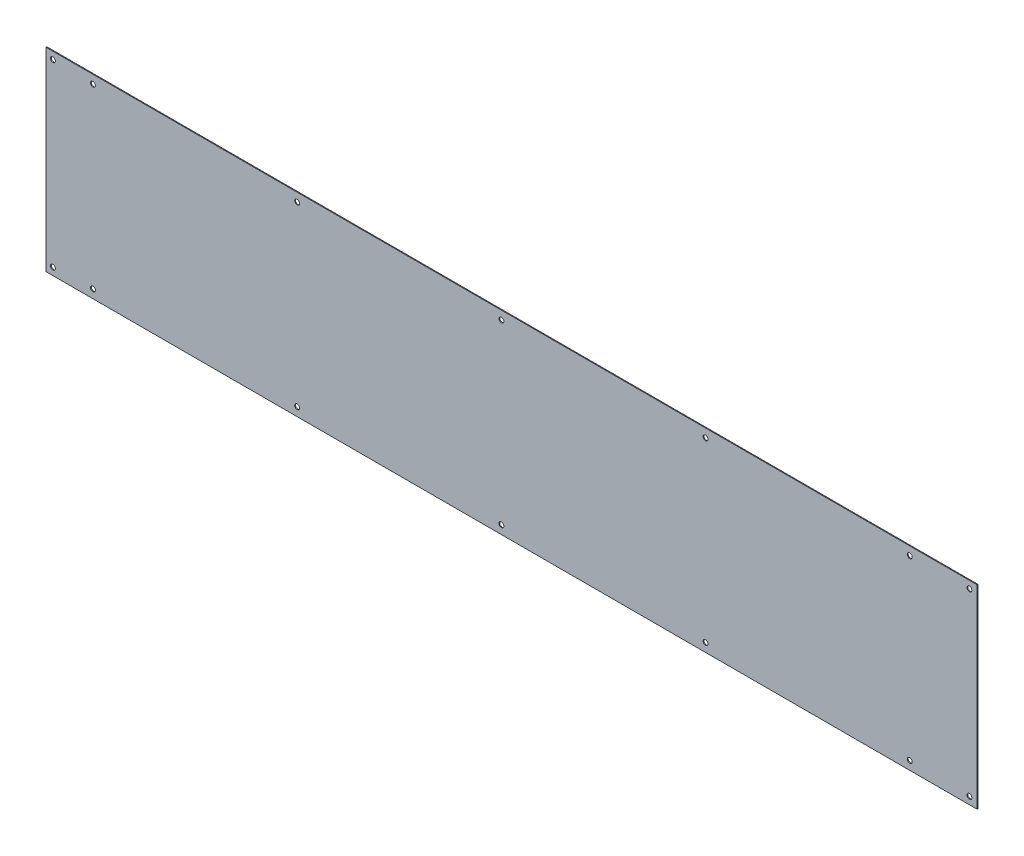
from build123d import *

# Parameters (mm, degrees)
SKETCH_1_W             = 1140
SKETCH_1_H             = 238
SKETCH_1_R             = 3
SM_BASE_FLANGE_1_DEPTH = 1
CUT_EXTRUDE_1_REACH    = 584.29
SKETCH_3_R             = 3


# Sheet-metal steps are written as plain solids
with BuildPart() as part:
    # Sketch 1 → 基体-法兰1 (new body)
    with BuildSketch(Plane.XY):
        Rectangle(SKETCH_1_W, SKETCH_1_H)
        with Locations((-561.5, 110)):
            Circle(SKETCH_1_R, mode=Mode.SUBTRACT)
        with Locations((-561.5, -110)):
            Circle(SKETCH_1_R, mode=Mode.SUBTRACT)
        with Locations((560.5, 110)):
            Circle(SKETCH_1_R, mode=Mode.SUBTRACT)
        with Locations((560.5, -110)):
            Circle(SKETCH_1_R, mode=Mode.SUBTRACT)
    extrude(amount=-SM_BASE_FLANGE_1_DEPTH)

    # 草图3 → 切除-拉伸1 (cut, up to next)
    with BuildSketch(Plane.XY, mode=Mode.PRIVATE) as cut_extrude_1_sk1:
        with Locations((-512.5, 108.5)):
            Circle(SKETCH_3_R)
    cut_extrude_1_tool1 = extrude(cut_extrude_1_sk1.sketch, amount=-CUT_EXTRUDE_1_REACH, mode=Mode.PRIVATE) & part.part
    # 草图3 → 切除-拉伸1 (cut, up to next)
    with BuildSketch(Plane.XY, mode=Mode.PRIVATE) as cut_extrude_1_sk2:
        with Locations((-262.5, 108.5)):
            Circle(SKETCH_3_R)
    cut_extrude_1_tool2 = extrude(cut_extrude_1_sk2.sketch, amount=-CUT_EXTRUDE_1_REACH, mode=Mode.PRIVATE) & part.part
    # 草图3 → 切除-拉伸1 (cut, up to next)
    with BuildSketch(Plane.XY, mode=Mode.PRIVATE) as cut_extrude_1_sk3:
        with Locations((-12.5, 108.5)):
            Circle(SKETCH_3_R)
    cut_extrude_1_tool3 = extrude(cut_extrude_1_sk3.sketch, amount=-CUT_EXTRUDE_1_REACH, mode=Mode.PRIVATE) & part.part
    # 草图3 → 切除-拉伸1 (cut, up to next)
    with BuildSketch(Plane.XY, mode=Mode.PRIVATE) as cut_extrude_1_sk4:
        with Locations((237.5, 108.5)):
            Circle(SKETCH_3_R)
    cut_extrude_1_tool4 = extrude(cut_extrude_1_sk4.sketch, amount=-CUT_EXTRUDE_1_REACH, mode=Mode.PRIVATE) & part.part
    # 草图3 → 切除-拉伸1 (cut, up to next)
    with BuildSketch(Plane.XY, mode=Mode.PRIVATE) as cut_extrude_1_sk5:
        with Locations((487.5, 108.5)):
            Circle(SKETCH_3_R)
    cut_extrude_1_tool5 = extrude(cut_extrude_1_sk5.sketch, amount=-CUT_EXTRUDE_1_REACH, mode=Mode.PRIVATE) & part.part
    # 草图3 → 切除-拉伸1 (cut, up to next)
    with BuildSketch(Plane.XY, mode=Mode.PRIVATE) as cut_extrude_1_sk6:
        with Locations((-512.5, -108.5)):
            Circle(SKETCH_3_R)
    cut_extrude_1_tool6 = extrude(cut_extrude_1_sk6.sketch, amount=-CUT_EXTRUDE_1_REACH, mode=Mode.PRIVATE) & part.part
    # 草图3 → 切除-拉伸1 (cut, up to next)
    with BuildSketch(Plane.XY, mode=Mode.PRIVATE) as cut_extrude_1_sk7:
        with Locations((-262.5, -108.5)):
            Circle(SKETCH_3_R)
    cut_extrude_1_tool7 = extrude(cut_extrude_1_sk7.sketch, amount=-CUT_EXTRUDE_1_REACH, mode=Mode.PRIVATE) & part.part
    # 草图3 → 切除-拉伸1 (cut, up to next)
    with BuildSketch(Plane.XY, mode=Mode.PRIVATE) as cut_extrude_1_sk8:
        with Locations((-12.5, -108.5)):
            Circle(SKETCH_3_R)
    cut_extrude_1_tool8 = extrude(cut_extrude_1_sk8.sketch, amount=-CUT_EXTRUDE_1_REACH, mode=Mode.PRIVATE) & part.part
    # 草图3 → 切除-拉伸1 (cut, up to next)
    with BuildSketch(Plane.XY, mode=Mode.PRIVATE) as cut_extrude_1_sk9:
        with Locations((237.5, -108.5)):
            Circle(SKETCH_3_R)
    cut_extrude_1_tool9 = extrude(cut_extrude_1_sk9.sketch, amount=-CUT_EXTRUDE_1_REACH, mode=Mode.PRIVATE) & part.part
    # 草图3 → 切除-拉伸1 (cut, up to next)
    with BuildSketch(Plane.XY, mode=Mode.PRIVATE) as cut_extrude_1_sk10:
        with Locations((487.5, -108.5)):
            Circle(SKETCH_3_R)
    cut_extrude_1_tool10 = extrude(cut_extrude_1_sk10.sketch, amount=-CUT_EXTRUDE_1_REACH, mode=Mode.PRIVATE) & part.part
    add(cut_extrude_1_tool1.solids().sort_by_distance((-512.5, 108.5, 0))[0], mode=Mode.SUBTRACT)
    add(cut_extrude_1_tool2.solids().sort_by_distance((-262.5, 108.5, 0))[0], mode=Mode.SUBTRACT)
    add(cut_extrude_1_tool3.solids().sort_by_distance((-12.5, 108.5, 0))[0], mode=Mode.SUBTRACT)
    add(cut_extrude_1_tool4.solids().sort_by_distance((237.5, 108.5, 0))[0], mode=Mode.SUBTRACT)
    add(cut_extrude_1_tool5.solids().sort_by_distance((487.5, 108.5, 0))[0], mode=Mode.SUBTRACT)
    add(cut_extrude_1_tool6.solids().sort_by_distance((-512.5, -108.5, 0))[0], mode=Mode.SUBTRACT)
    add(cut_extrude_1_tool7.solids().sort_by_distance((-262.5, -108.5, 0))[0], mode=Mode.SUBTRACT)
    add(cut_extrude_1_tool8.solids().sort_by_distance((-12.5, -108.5, 0))[0], mode=Mode.SUBTRACT)
    add(cut_extrude_1_tool9.solids().sort_by_distance((237.5, -108.5, 0))[0], mode=Mode.SUBTRACT)
    add(cut_extrude_1_tool10.solids().sort_by_distance((487.5, -108.5, 0))[0], mode=Mode.SUBTRACT)


solid = part.part
